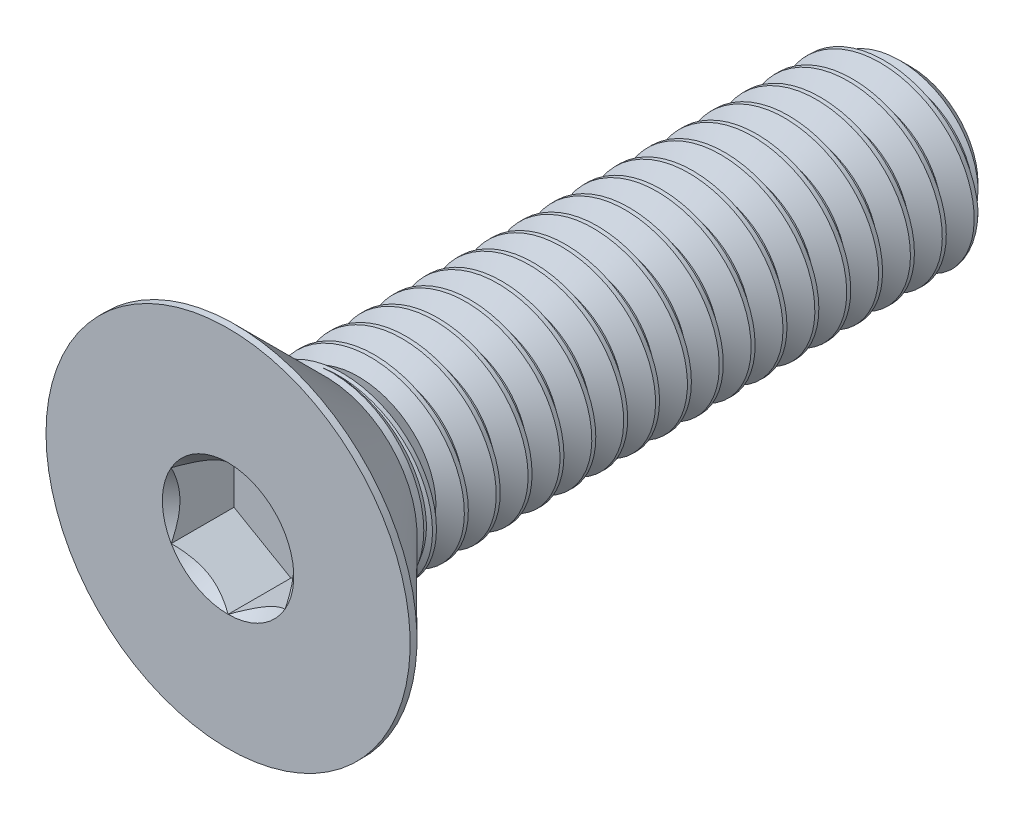
from build123d import *
from OCP.BRepAlgoAPI import BRepAlgoAPI_Cut
from OCP.TopTools import TopTools_ListOfShape

# Parameters (mm, degrees)
CUT_EXTRUDE2_DEPTH = 1.38
CUT_SWEEP1_PITCH   = 0.7
CUT_SWEEP1_TO      = 12.7


with BuildPart() as part:
    # Sketch14 → Revolve1 (revolve)
    with BuildSketch(Plane(origin=(0, 0, 0), x_dir=(0, 0, -1), z_dir=(1, 0, 0)), mode=Mode.PRIVATE) as revolve1_sk:
        Polygon((-8.65, 0), (-8.65, 4), (-8.5, 4), (-6.5, 2), (-6.35, 2), (5.825, 2), (6.35, 1.475), (6.35, 0), align=None)
    revolve(revolve1_sk.sketch.rotate(Axis((0, 0, -6.35), (0, 0, 1)), 90), axis=Axis((0, 0, -6.35), (0, 0, 1)))

    # Sketch5 → Cut-Extrude2 (cut)
    with BuildSketch(Plane.XY.offset(8.65)):
        Polygon((0, -1.443375673), (1.25, -0.721687836), (1.25, 0.721687836), (0, 1.443375673), (-1.25, 0.721687836), (-1.25, -0.721687836), align=None)
    extrude(amount=-CUT_EXTRUDE2_DEPTH, mode=Mode.SUBTRACT)


with BuildPart() as cut_extrude3_tool:
    # Cut-Extrude3: read off the stored shape, not the designer's step
    # Cut-Extrude3: loft between two sections, ruled curve by curve
    cut_extrude3_from = [
        Edge.make_three_point_arc((0, -1.249843418, 8.456467745), (0.624921709, -1.08239615, 8.456467745), (1.08239615, -0.624921709, 8.456467745)),
        Edge.make_line((1.08239615, -0.624921709, 8.456467745), (0, -1.249843418, 8.456467745)),
    ]
    cut_extrude3_to = [
        Edge.make_three_point_arc((0, -1.443375706, 8.650000033), (0.721687853, -1.250000029, 8.650000033), (1.250000029, -0.721687853, 8.650000033)),
        Edge.make_line((1.250000029, -0.721687853, 8.650000033), (0, -1.443375706, 8.650000033)),
    ]
    cut_extrude3 = Solid(Shell([*[Face.make_surface_from_curves(cut_extrude3_from[k], cut_extrude3_to[k]) for k in range(2)], Face(Wire(cut_extrude3_from)), Face(Wire(cut_extrude3_to))]))
    add(cut_extrude3)


with BuildPart() as part_1:
    add(part.part)

    # Cut-Extrude3: cut by cut_extrude3_tool, with a tolerance
    cut_extrude3_stock = TopTools_ListOfShape()
    cut_extrude3_stock.Append(part_1.part.wrapped)
    cut_extrude3_tools = TopTools_ListOfShape()
    cut_extrude3_tools.Append(cut_extrude3_tool.part.wrapped)
    cut_extrude3_cut = BRepAlgoAPI_Cut()
    cut_extrude3_cut.SetArguments(cut_extrude3_stock)
    cut_extrude3_cut.SetTools(cut_extrude3_tools)
    cut_extrude3_cut.SetFuzzyValue(0.00001)
    cut_extrude3_cut.Build()
    add(Compound.cast(cut_extrude3_cut.Shape()).solids(), mode=Mode.REPLACE)


with BuildPart() as cut_extrude3_2_tool:
    # Cut-Extrude3 2: loft between two sections, ruled curve by curve
    cut_extrude3_2_from = [
        Edge.make_three_point_arc((1.082395247, -0.62492253, 8.456467373), (1.249843046, -5.66e-07, 8.456467373), (1.082395813, 0.624921549, 8.456467373)),
        Edge.make_line((1.082395813, 0.624921549, 8.456467373), (1.082395247, -0.62492253, 8.456467373)),
    ]
    cut_extrude3_2_to = [
        Edge.make_three_point_arc((1.249999329, -0.721689, 8.65), (1.443375673, -6.54e-07, 8.65), (1.249999982, 0.721687867, 8.65)),
        Edge.make_line((1.249999982, 0.721687867, 8.65), (1.249999329, -0.721689, 8.65)),
    ]
    cut_extrude3_2 = Solid(Shell([*[Face.make_surface_from_curves(cut_extrude3_2_from[k], cut_extrude3_2_to[k]) for k in range(2)], Face(Wire(cut_extrude3_2_from)), Face(Wire(cut_extrude3_2_to))]))
    add(cut_extrude3_2)


with BuildPart() as part_2:
    add(part_1.part)

    # Cut-Extrude3 2: cut by cut_extrude3_2_tool, with a tolerance
    cut_extrude3_2_stock = TopTools_ListOfShape()
    cut_extrude3_2_stock.Append(part_2.part.wrapped)
    cut_extrude3_2_tools = TopTools_ListOfShape()
    cut_extrude3_2_tools.Append(cut_extrude3_2_tool.part.wrapped)
    cut_extrude3_2_cut = BRepAlgoAPI_Cut()
    cut_extrude3_2_cut.SetArguments(cut_extrude3_2_stock)
    cut_extrude3_2_cut.SetTools(cut_extrude3_2_tools)
    cut_extrude3_2_cut.SetFuzzyValue(0.00001)
    cut_extrude3_2_cut.Build()
    add(Compound.cast(cut_extrude3_2_cut.Shape()).solids(), mode=Mode.REPLACE)


with BuildPart() as cut_extrude3_3_tool:
    # Cut-Extrude3 3: loft between two sections, ruled curve by curve
    cut_extrude3_3_from = [
        Edge.make_three_point_arc((1.08239615, 0.624921709, 8.456467745), (0.624921709, 1.08239615, 8.456467745), (0, 1.249843418, 8.456467745)),
        Edge.make_line((0, 1.249843418, 8.456467745), (1.08239615, 0.624921709, 8.456467745)),
    ]
    cut_extrude3_3_to = [
        Edge.make_three_point_arc((1.250000029, 0.721687853, 8.650000033), (0.721687853, 1.250000029, 8.650000033), (0, 1.443375706, 8.650000033)),
        Edge.make_line((0, 1.443375706, 8.650000033), (1.250000029, 0.721687853, 8.650000033)),
    ]
    cut_extrude3_3 = Solid(Shell([*[Face.make_surface_from_curves(cut_extrude3_3_from[k], cut_extrude3_3_to[k]) for k in range(2)], Face(Wire(cut_extrude3_3_from)), Face(Wire(cut_extrude3_3_to))]))
    add(cut_extrude3_3)


with BuildPart() as part_3:
    add(part_2.part)

    # Cut-Extrude3 3: cut by cut_extrude3_3_tool, with a tolerance
    cut_extrude3_3_stock = TopTools_ListOfShape()
    cut_extrude3_3_stock.Append(part_3.part.wrapped)
    cut_extrude3_3_tools = TopTools_ListOfShape()
    cut_extrude3_3_tools.Append(cut_extrude3_3_tool.part.wrapped)
    cut_extrude3_3_cut = BRepAlgoAPI_Cut()
    cut_extrude3_3_cut.SetArguments(cut_extrude3_3_stock)
    cut_extrude3_3_cut.SetTools(cut_extrude3_3_tools)
    cut_extrude3_3_cut.SetFuzzyValue(0.00001)
    cut_extrude3_3_cut.Build()
    add(Compound.cast(cut_extrude3_3_cut.Shape()).solids(), mode=Mode.REPLACE)


with BuildPart() as cut_extrude3_4_tool:
    # Cut-Extrude3 4: loft between two sections, ruled curve by curve
    cut_extrude3_4_from = [
        Edge.make_three_point_arc((0, 1.249843418, 8.456467745), (-0.624921709, 1.08239615, 8.456467745), (-1.08239615, 0.624921709, 8.456467745)),
        Edge.make_line((-1.08239615, 0.624921709, 8.456467745), (0, 1.249843418, 8.456467745)),
    ]
    cut_extrude3_4_to = [
        Edge.make_three_point_arc((0, 1.443375706, 8.650000033), (-0.721687853, 1.250000029, 8.650000033), (-1.250000029, 0.721687853, 8.650000033)),
        Edge.make_line((-1.250000029, 0.721687853, 8.650000033), (0, 1.443375706, 8.650000033)),
    ]
    cut_extrude3_4 = Solid(Shell([*[Face.make_surface_from_curves(cut_extrude3_4_from[k], cut_extrude3_4_to[k]) for k in range(2)], Face(Wire(cut_extrude3_4_from)), Face(Wire(cut_extrude3_4_to))]))
    add(cut_extrude3_4)


with BuildPart() as part_4:
    add(part_3.part)

    # Cut-Extrude3 4: cut by cut_extrude3_4_tool, with a tolerance
    cut_extrude3_4_stock = TopTools_ListOfShape()
    cut_extrude3_4_stock.Append(part_4.part.wrapped)
    cut_extrude3_4_tools = TopTools_ListOfShape()
    cut_extrude3_4_tools.Append(cut_extrude3_4_tool.part.wrapped)
    cut_extrude3_4_cut = BRepAlgoAPI_Cut()
    cut_extrude3_4_cut.SetArguments(cut_extrude3_4_stock)
    cut_extrude3_4_cut.SetTools(cut_extrude3_4_tools)
    cut_extrude3_4_cut.SetFuzzyValue(0.00001)
    cut_extrude3_4_cut.Build()
    add(Compound.cast(cut_extrude3_4_cut.Shape()).solids(), mode=Mode.REPLACE)


with BuildPart() as cut_extrude3_5_tool:
    # Cut-Extrude3 5: loft between two sections, ruled curve by curve
    cut_extrude3_5_from = [
        Edge.make_three_point_arc((-1.082395813, 0.624921549, 8.456467373), (-1.249843046, -5.66e-07, 8.456467373), (-1.082395247, -0.62492253, 8.456467373)),
        Edge.make_line((-1.082395247, -0.62492253, 8.456467373), (-1.082395813, 0.624921549, 8.456467373)),
    ]
    cut_extrude3_5_to = [
        Edge.make_three_point_arc((-1.249999982, 0.721687867, 8.65), (-1.443375673, -6.54e-07, 8.65), (-1.249999329, -0.721689, 8.65)),
        Edge.make_line((-1.249999329, -0.721689, 8.65), (-1.249999982, 0.721687867, 8.65)),
    ]
    cut_extrude3_5 = Solid(Shell([*[Face.make_surface_from_curves(cut_extrude3_5_from[k], cut_extrude3_5_to[k]) for k in range(2)], Face(Wire(cut_extrude3_5_from)), Face(Wire(cut_extrude3_5_to))]))
    add(cut_extrude3_5)


with BuildPart() as part_5:
    add(part_4.part)

    # Cut-Extrude3 5: cut by cut_extrude3_5_tool, with a tolerance
    cut_extrude3_5_stock = TopTools_ListOfShape()
    cut_extrude3_5_stock.Append(part_5.part.wrapped)
    cut_extrude3_5_tools = TopTools_ListOfShape()
    cut_extrude3_5_tools.Append(cut_extrude3_5_tool.part.wrapped)
    cut_extrude3_5_cut = BRepAlgoAPI_Cut()
    cut_extrude3_5_cut.SetArguments(cut_extrude3_5_stock)
    cut_extrude3_5_cut.SetTools(cut_extrude3_5_tools)
    cut_extrude3_5_cut.SetFuzzyValue(0.00001)
    cut_extrude3_5_cut.Build()
    add(Compound.cast(cut_extrude3_5_cut.Shape()).solids(), mode=Mode.REPLACE)


with BuildPart() as cut_extrude3_6_tool:
    # Cut-Extrude3 6: loft between two sections, ruled curve by curve
    cut_extrude3_6_from = [
        Edge.make_three_point_arc((-1.08239615, -0.624921709, 8.456467745), (-0.624921709, -1.08239615, 8.456467745), (0, -1.249843418, 8.456467745)),
        Edge.make_line((0, -1.249843418, 8.456467745), (-1.08239615, -0.624921709, 8.456467745)),
    ]
    cut_extrude3_6_to = [
        Edge.make_three_point_arc((-1.250000029, -0.721687853, 8.650000033), (-0.721687853, -1.250000029, 8.650000033), (0, -1.443375706, 8.650000033)),
        Edge.make_line((0, -1.443375706, 8.650000033), (-1.250000029, -0.721687853, 8.650000033)),
    ]
    cut_extrude3_6 = Solid(Shell([*[Face.make_surface_from_curves(cut_extrude3_6_from[k], cut_extrude3_6_to[k]) for k in range(2)], Face(Wire(cut_extrude3_6_from)), Face(Wire(cut_extrude3_6_to))]))
    add(cut_extrude3_6)


with BuildPart() as part_6:
    add(part_5.part)

    # Cut-Extrude3 6: cut by cut_extrude3_6_tool, with a tolerance
    cut_extrude3_6_stock = TopTools_ListOfShape()
    cut_extrude3_6_stock.Append(part_6.part.wrapped)
    cut_extrude3_6_tools = TopTools_ListOfShape()
    cut_extrude3_6_tools.Append(cut_extrude3_6_tool.part.wrapped)
    cut_extrude3_6_cut = BRepAlgoAPI_Cut()
    cut_extrude3_6_cut.SetArguments(cut_extrude3_6_stock)
    cut_extrude3_6_cut.SetTools(cut_extrude3_6_tools)
    cut_extrude3_6_cut.SetFuzzyValue(0.00001)
    cut_extrude3_6_cut.Build()
    add(Compound.cast(cut_extrude3_6_cut.Shape()).solids(), mode=Mode.REPLACE)


with BuildPart() as body_2:
    # Split1: the piece on the far side of the plane
    add(part_6.part)
    split(bisect_by=Plane.XY.offset(6.35), keep=Keep.BOTTOM)

    # Cut-Sweep1: arcs per turn and ends read off the stored shape
    # Cut-Sweep1: the profile of Sketch16 screwed along a right-hand helix through 21.428571 turns, 6 arcs to a turn; built about Z, then put on its axis
    cut_sweep1_z = Axis((0, 0, 0), (0, 0, 1))
    cut_sweep1_corners = [(1.545336663, 0, -0.35), (1.545336663, 0, -0.2625), (2.037888611, 0, 0.021875), (2.037888611, 0, -0.634375)]
    with BuildLine(mode=Mode.PRIVATE) as cut_sweep1_profile:
        Line(cut_sweep1_corners[0], cut_sweep1_corners[1])
        Line(cut_sweep1_corners[1], cut_sweep1_corners[2])
        Line(cut_sweep1_corners[2], cut_sweep1_corners[3])
        Line(cut_sweep1_corners[3], cut_sweep1_corners[0])
    cut_sweep1_cap = Face(cut_sweep1_profile.wire())
    cut_sweep1_turn_angles = [0, 30, 60, 90, 120, 150, 180, 210, 240, 270, 300, 330, 360]
    cut_sweep1_turn_weights = [1, 0.8660254037844387, 1, 0.8660254037844387, 1, 0.8660254037844387, 1, 0.8660254037844387, 1, 0.8660254037844387, 1, 0.8660254037844387, 1]
    cut_sweep1_turn_rails = [Edge.make_bspline([Vector(p[0], p[1], 0).rotate(cut_sweep1_z, cut_sweep1_turn_angles[k]) / cut_sweep1_turn_weights[k] + Vector(0, 0, p[2] + CUT_SWEEP1_PITCH * cut_sweep1_turn_angles[k] / 360) for k in range(13)], [0, 0, 0, 1, 1, 2, 2, 3, 3, 4, 4, 5, 5, 6, 6, 6], 2, cut_sweep1_turn_weights) for p in cut_sweep1_corners]
    cut_sweep1_turn_sides = [Face.make_surface_from_curves(cut_sweep1_turn_rails[p[0]], cut_sweep1_turn_rails[p[1]]) for p in [(0, 1), (1, 2), (2, 3), (3, 0)]]
    cut_sweep1_last_angles = [7560, 7590, 7620, 7650, 7680, 7697.142857143, 7714.285714286]
    cut_sweep1_last_weights = [1, 0.8660254037844387, 1, 0.8660254037844387, 1, 0.9555728057859362, 1]
    cut_sweep1_last_rails = [Edge.make_bspline([Vector(p[0], p[1], 0).rotate(cut_sweep1_z, cut_sweep1_last_angles[k]) / cut_sweep1_last_weights[k] + Vector(0, 0, p[2] + CUT_SWEEP1_PITCH * cut_sweep1_last_angles[k] / 360) for k in range(7)], [0, 0, 0, 1, 1, 2, 2, 3, 3, 3], 2, cut_sweep1_last_weights) for p in cut_sweep1_corners]
    cut_sweep1_last_sides = [Face.make_surface_from_curves(cut_sweep1_last_rails[p[0]], cut_sweep1_last_rails[p[1]]) for p in [(0, 1), (1, 2), (2, 3), (3, 0)]]
    cut_sweep1 = Plane(origin=(0, 0, -6.35), x_dir=(0, 1, 0), z_dir=(0, 0, 1)) * split(Solid(Shell([*[p.moved(Location((0, 0, CUT_SWEEP1_PITCH * i))) for i in range(21) for p in cut_sweep1_turn_sides], *cut_sweep1_last_sides, cut_sweep1_cap, cut_sweep1_cap.rotate(cut_sweep1_z, 7714.285714286).moved(Location((0, 0, CUT_SWEEP1_PITCH * 7714.285714286 / 360)))])), bisect_by=Plane.XY.offset(CUT_SWEEP1_TO), keep=Keep.BOTTOM, mode=Mode.PRIVATE)
    add(cut_sweep1, mode=Mode.SUBTRACT)


with BuildPart() as part_7:
    add(part_6.part)

    # Split1
    split(bisect_by=Plane.XY.offset(6.35), keep=Keep.TOP)

    add(body_2.part)  # Boss-Extrude1 merges body 2
    # Boss-Extrude1 cone 1 section (through the dimple's axis) → Boss-Extrude1 (revolve)
    with BuildSketch(Plane(origin=(0, 0, 6.35), x_dir=(0, -1, 0), z_dir=(1, 0, 0))):
        Polygon((0, 0), (2, 0), (0, 3.341756489), align=None)
    revolve(axis=Axis((0, 0, 6.35), (0, 0, -1)))


solid = part_7.part
